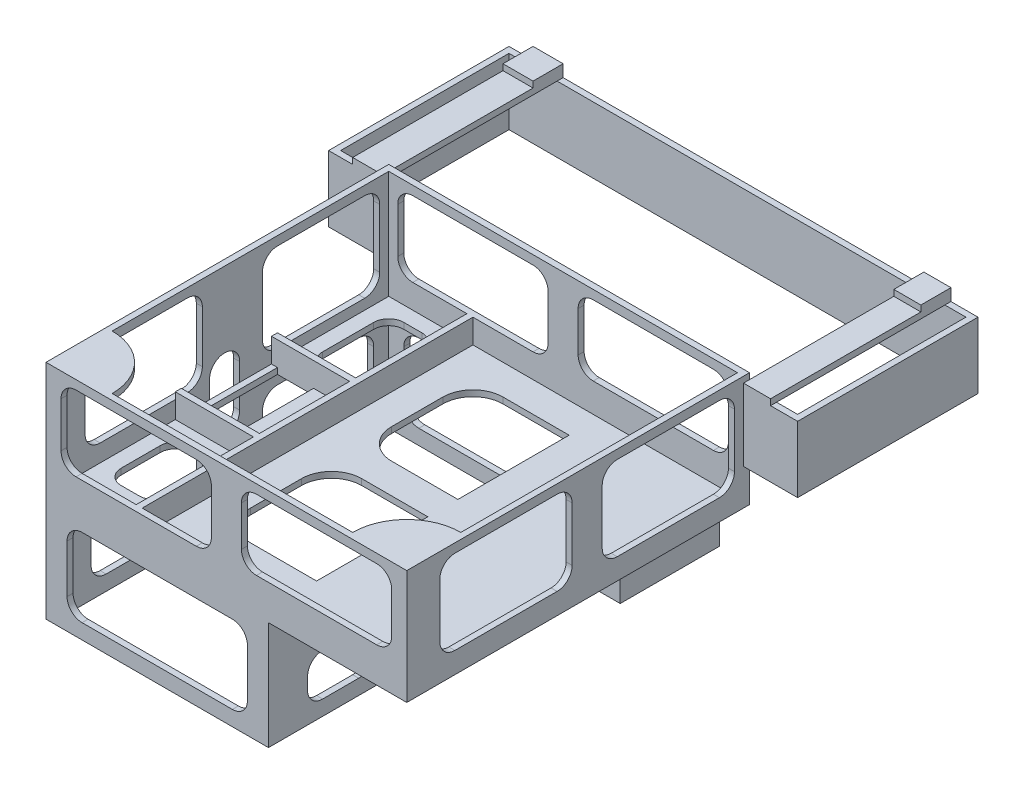
from build123d import *

# Parameters (mm, degrees)
SKETCH1_W                = 60
SKETCH1_H                = 54
BOSS_EXTRUDE1_DEPTH      = 38
SKETCH2_W                = 44
SKETCH2_H                = 52
CUT_EXTRUDE1_DEPTH       = 19
SKETCH3_W                = 35
SKETCH3_H                = 52
CUT_EXTRUDE2_DEPTH       = 18
SKETCH4_W                = 6
SKETCH4_H                = 15
CUT_EXTRUDE3_DEPTH       = 38
SKETCH5_W                = 14
SKETCH5_H                = 52
CUT_EXTRUDE5_DEPTH       = 15
SKETCH6_W                = 13
SKETCH6_H                = 52
CUT_EXTRUDE6_DEPTH       = 4
SKETCH8_W                = 14
SKETCH8_H                = 12.5
CUT_EXTRUDE7_DEPTH       = 6
SKETCH10_W               = 12.5
SKETCH10_H               = 5
CUT_EXTRUDE8_DEPTH       = 6
SKETCH11_W               = 4.5
SKETCH11_H               = 5
CUT_EXTRUDE9_DEPTH       = 18
SKETCH12_W               = 5
SKETCH12_H               = 17
CUT_EXTRUDE10_DEPTH      = 13
CUT_EXTRUDE11_DEPTH      = 1
SKETCH14_W               = 13
SKETCH14_H               = 1
BOSS_EXTRUDE2_DEPTH      = 4
SKETCH15_W               = 13
SKETCH15_H               = 1
BOSS_EXTRUDE3_DEPTH      = 4
CUT_EXTRUDE12_DEPTH      = 1
CUT_EXTRUDE13_DEPTH      = 1
CUT_EXTRUDE14_DEPTH      = 1
CUT_EXTRUDE15_DEPTH      = 60
CUT_EXTRUDE16_START      = -1
CUT_EXTRUDE16_DEPTH      = 1
CUT_EXTRUDE17_DEPTH      = 89
CUT_EXTRUDE17_DEPTH_BACK = 10
CUT_EXTRUDE18_DEPTH      = 10
SKETCH23_W               = 58
SKETCH23_H               = 52
BOSS_EXTRUDE4_DEPTH      = 1
SKETCH24_W               = 40
SKETCH24_H               = 10
SKETCH24_W_2             = 10
SKETCH24_H_2             = 34
CUT_EXTRUDE20_DEPTH      = 1
FILLET1_R                = 9
FILLET2_R                = 9
FILLET3_R                = 9
FILLET4_R                = 9
SKETCH27_W               = 10
SKETCH27_H               = 11
BOSS_EXTRUDE10_DEPTH     = 1
SKETCH31_W               = 1
SKETCH31_H               = 11
BOSS_EXTRUDE12_DEPTH     = 29
SKETCH33_W               = 1
SKETCH33_H               = 11
BOSS_EXTRUDE13_DEPTH     = 78
SKETCH34_W               = 5
SKETCH34_H               = 30
SKETCH34_W_2             = 4.5
BOSS_EXTRUDE14_DEPTH     = 1
SKETCH35_W               = 28
SKETCH35_H               = 11
BOSS_EXTRUDE15_DEPTH     = 1
SKETCH37_W               = 30
SKETCH37_H               = 11
CUT_EXTRUDE21_DEPTH      = 1
SKETCH38_W               = 28
SKETCH38_H               = 11
BOSS_EXTRUDE16_DEPTH     = 1
SKETCH39_W               = 30
SKETCH39_H               = 11
CUT_EXTRUDE22_DEPTH      = 1
SKETCH40_W               = 60
SKETCH40_H               = 37
BOSS_EXTRUDE17_DEPTH     = 3
SKETCH41_W               = 35
SKETCH41_H               = 18
CUT_EXTRUDE23_DEPTH      = 3
SKETCH42_W               = 44
SKETCH42_H               = 18
CUT_EXTRUDE24_DEPTH      = 3
SKETCH44_W               = 13
SKETCH44_H               = 18
CUT_EXTRUDE25_DEPTH      = 3
SKETCH45_W               = 3
SKETCH45_H               = 14
CUT_EXTRUDE26_DEPTH      = 3
SKETCH47_W               = 60
SKETCH47_H               = 10
CUT_EXTRUDE27_DEPTH      = 1
SKETCH48_W               = 60
SKETCH48_H               = 10
CUT_EXTRUDE28_DEPTH      = 1
SKETCH49_W               = 60
SKETCH49_H               = 10
BOSS_EXTRUDE18_DEPTH     = 1
SKETCH50_W               = 40
SKETCH50_H               = 9
CUT_EXTRUDE29_DEPTH      = 1
FILLET5_R                = 9
FILLET6_R                = 9
SKETCH51_W               = 5
SKETCH51_H               = 5
SKETCH51_W_2             = 4.5
BOSS_EXTRUDE19_DEPTH     = 1
SKETCH53_W               = 8
SKETCH53_H               = 9
CUT_EXTRUDE30_DEPTH      = 18
SKETCH54_W               = 2.5
SKETCH54_H               = 16.5
CUT_EXTRUDE31_DEPTH      = 18
SKETCH55_W               = 19.362337095
SKETCH55_H               = 47.149460103
BOSS_EXTRUDE20_DEPTH     = 1
SKETCH57_W               = 15
SKETCH57_H               = 9
CUT_EXTRUDE32_DEPTH      = 15
SKETCH58_W               = 6.289823119
SKETCH58_H               = 14.401479923
BOSS_EXTRUDE21_DEPTH     = 1
SKETCH59_W               = 15
SKETCH59_H               = 9
BOSS_EXTRUDE26_DEPTH     = 1
SKETCH60_W               = 4.5
SKETCH60_H               = 5
CUT_EXTRUDE33_DEPTH      = 1
SKETCH61_W               = 14
SKETCH61_H               = 12.5
CUT_EXTRUDE34_DEPTH      = 18
SKETCH62_W               = 12.5
SKETCH62_H               = 5
CUT_EXTRUDE35_DEPTH      = 18
SKETCH63_W               = 20.5
SKETCH63_H               = 16.5
CUT_EXTRUDE36_DEPTH      = 12
SKETCH64_W               = 13.575669256
SKETCH64_H               = 6.720460735
BOSS_EXTRUDE27_DEPTH     = 1
CUT_EXTRUDE37_START      = -1
CUT_EXTRUDE37_DEPTH      = 1
CUT_EXTRUDE38_DEPTH      = 1
CUT_EXTRUDE39_DEPTH      = 1


with BuildPart() as part:
    # Sketch1 → Boss-Extrude1 (new body)
    with BuildSketch(Plane(origin=(0, 0, 0), x_dir=(1, 0, 0), z_dir=(0, 1, 0))):
        with Locations((-83.874465942, -33.946435202)):
            Rectangle(SKETCH1_W, SKETCH1_H)
    extrude(amount=BOSS_EXTRUDE1_DEPTH)

    # Sketch2 → Cut-Extrude1 (cut)
    with BuildSketch(Plane(origin=(0, 38, 0), x_dir=(1, 0, 0), z_dir=(0, 1, 0))):
        with Locations((-76.874465942, -33.946435202)):
            Rectangle(SKETCH2_W, SKETCH2_H)
    extrude(amount=-CUT_EXTRUDE1_DEPTH, mode=Mode.SUBTRACT)

    # Sketch3 → Cut-Extrude2 (cut)
    with BuildSketch(Plane(origin=(0, 0, 0), x_dir=(-1, 0, 0), z_dir=(0, -1, 0))):
        with Locations((95.374465942, -33.946435202)):
            Rectangle(SKETCH3_W, SKETCH3_H)
    extrude(amount=-CUT_EXTRUDE2_DEPTH, mode=Mode.SUBTRACT)

    # Sketch4 → Cut-Extrude3 (cut)
    with BuildSketch(Plane(origin=(0, 18, 0), x_dir=(-1, 0, 0), z_dir=(0, -1, 0))):
        with Locations((108.874465942, -34.946435202)):
            Rectangle(SKETCH4_W, SKETCH4_H)
    extrude(amount=-CUT_EXTRUDE3_DEPTH, mode=Mode.SUBTRACT)

    # Sketch5 → Cut-Extrude5 (cut)
    with BuildSketch(Plane(origin=(0, 38, 0), x_dir=(1, 0, 0), z_dir=(0, 1, 0))):
        with Locations((-105.874465942, -33.946435202)):
            Rectangle(SKETCH5_W, SKETCH5_H)
    extrude(amount=-CUT_EXTRUDE5_DEPTH, mode=Mode.SUBTRACT)

    # Sketch6 → Cut-Extrude6 (cut)
    with BuildSketch(Plane(origin=(0, 23, 0), x_dir=(1, 0, 0), z_dir=(0, 1, 0))):
        with Locations((-106.374465942, -33.946435202)):
            Rectangle(SKETCH6_W, SKETCH6_H)
    extrude(amount=-CUT_EXTRUDE6_DEPTH, mode=Mode.SUBTRACT)

    # Sketch8 → Cut-Extrude7 (cut)
    with BuildSketch(Plane(origin=(0, 0, 0), x_dir=(-1, 0, 0), z_dir=(0, -1, 0))):
        with Locations((65.374465942, -17.696435202)):
            Rectangle(SKETCH8_W, SKETCH8_H)
    extrude(amount=-CUT_EXTRUDE7_DEPTH, mode=Mode.SUBTRACT)

    # Sketch10 → Cut-Extrude8 (cut)
    with BuildSketch(Plane(origin=(-72.374465942, 0, 0), x_dir=(0, 0, -1), z_dir=(1, 0, 0))):
        with Locations((-17.696435202, 3.5)):
            Rectangle(SKETCH10_W, SKETCH10_H)
    extrude(amount=-CUT_EXTRUDE8_DEPTH, mode=Mode.SUBTRACT)

    # Sketch11 → Cut-Extrude9 (cut)
    with BuildSketch(Plane.XZ):
        with Locations((-66.124465942, 48.446435202)):
            Rectangle(SKETCH11_W, SKETCH11_H)
    extrude(amount=-CUT_EXTRUDE9_DEPTH, mode=Mode.SUBTRACT)

    # Sketch12 → Cut-Extrude10 (cut)
    with BuildSketch(Plane(origin=(-68.374465942, 0, 0), x_dir=(0, 0, -1), z_dir=(1, 0, 0))):
        with Locations((-48.446435202, 9.5)):
            Rectangle(SKETCH12_W, SKETCH12_H)
    extrude(amount=-CUT_EXTRUDE10_DEPTH, mode=Mode.SUBTRACT)

    # Sketch13 → Cut-Extrude11 (cut)
    with BuildSketch(Plane.ZY.offset(113.874465942)):
        with BuildLine():
            Line((32.733045904, 15), (32.733045904, 22))
            ThreePointArc((32.733045904, 22), (35.233045904, 24.5), (37.733045904, 22))
            Line((37.733045904, 22), (37.733045904, 15))
            ThreePointArc((37.733045904, 15), (35.233045904, 12.5), (32.733045904, 15))
        make_face()
    extrude(amount=-CUT_EXTRUDE11_DEPTH, mode=Mode.SUBTRACT)

    # Sketch14 → Boss-Extrude2 (add)
    with BuildSketch(Plane(origin=(0, 19, 0), x_dir=(1, 0, 0), z_dir=(0, 1, 0))):
        with Locations((-106.374465942, -42.946435202)):
            Rectangle(SKETCH14_W, SKETCH14_H)
    extrude(amount=BOSS_EXTRUDE2_DEPTH)

    # Sketch15 → Boss-Extrude3 (add)
    with BuildSketch(Plane(origin=(0, 19, 0), x_dir=(1, 0, 0), z_dir=(0, 1, 0))):
        with Locations((-106.374465942, -26.946435202)):
            Rectangle(SKETCH15_W, SKETCH15_H)
    extrude(amount=BOSS_EXTRUDE3_DEPTH)

    # Sketch16 → Cut-Extrude12 (cut)
    with BuildSketch(Plane(origin=(0, 19, 0), x_dir=(1, 0, 0), z_dir=(0, 1, 0))):
        with BuildLine():
            Line((-64.874465942, -54.946435202), (-88.874465942, -54.946435202))
            ThreePointArc((-88.874465942, -54.946435202), (-92.409999848, -53.481969108), (-93.874465942, -49.946435202))
            Line((-93.874465942, -49.946435202), (-93.874465942, -41.446435202))
            ThreePointArc((-93.874465942, -41.446435202), (-92.409999848, -37.910901296), (-88.874465942, -36.446435202))
            Line((-88.874465942, -36.446435202), (-64.874465942, -36.446435202))
            ThreePointArc((-64.874465942, -36.446435202), (-61.338932037, -37.910901296), (-59.874465942, -41.446435202))
            Line((-59.874465942, -41.446435202), (-59.874465942, -49.946435202))
            ThreePointArc((-59.874465942, -49.946435202), (-61.338932037, -53.481969108), (-64.874465942, -54.946435202))
        make_face()
        with BuildLine():
            Line((-88.874465942, -31.446435202), (-64.874465942, -31.446435202))
            ThreePointArc((-64.874465942, -31.446435202), (-61.338932037, -29.981969108), (-59.874465942, -26.446435202))
            Line((-59.874465942, -26.446435202), (-59.874465942, -17.946435202))
            ThreePointArc((-59.874465942, -17.946435202), (-61.338932037, -14.410901296), (-64.874465942, -12.946435202))
            Line((-64.874465942, -12.946435202), (-88.874465942, -12.946435202))
            ThreePointArc((-88.874465942, -12.946435202), (-92.409999848, -14.410901296), (-93.874465942, -17.946435202))
            Line((-93.874465942, -17.946435202), (-93.874465942, -26.446435202))
            ThreePointArc((-93.874465942, -26.446435202), (-92.409999848, -29.981969108), (-88.874465942, -31.446435202))
        make_face()
    extrude(amount=-CUT_EXTRUDE12_DEPTH, mode=Mode.SUBTRACT)

    # Sketch17 → Cut-Extrude13 (cut)
    with BuildSketch(Plane(origin=(0, 19, 0), x_dir=(1, 0, 0), z_dir=(0, 1, 0))):
        with BuildLine():
            Line((-104.874465942, -57.446435202), (-107.874465942, -57.446435202))
            ThreePointArc((-107.874465942, -57.446435202), (-109.642232895, -56.714202155), (-110.374465942, -54.946435202))
            Line((-110.374465942, -54.946435202), (-110.374465942, -48.446435202))
            ThreePointArc((-110.374465942, -48.446435202), (-109.642232895, -46.678668249), (-107.874465942, -45.946435202))
            Line((-107.874465942, -45.946435202), (-104.874465942, -45.946435202))
            ThreePointArc((-104.874465942, -45.946435202), (-103.10669899, -46.678668249), (-102.374465942, -48.446435202))
            Line((-102.374465942, -48.446435202), (-102.374465942, -54.946435202))
            ThreePointArc((-102.374465942, -54.946435202), (-103.10669899, -56.714202155), (-104.874465942, -57.446435202))
        make_face()
        with BuildLine():
            Line((-104.874465942, -23.946435202), (-107.874465942, -23.946435202))
            ThreePointArc((-107.874465942, -23.946435202), (-109.642232895, -23.214202155), (-110.374465942, -21.446435202))
            Line((-110.374465942, -21.446435202), (-110.374465942, -12.946435202))
            ThreePointArc((-110.374465942, -12.946435202), (-109.642232895, -11.178668249), (-107.874465942, -10.446435202))
            Line((-107.874465942, -10.446435202), (-104.874465942, -10.446435202))
            ThreePointArc((-104.874465942, -10.446435202), (-103.10669899, -11.178668249), (-102.374465942, -12.946435202))
            Line((-102.374465942, -12.946435202), (-102.374465942, -21.446435202))
            ThreePointArc((-102.374465942, -21.446435202), (-103.10669899, -23.214202155), (-104.874465942, -23.946435202))
        make_face()
    extrude(amount=-CUT_EXTRUDE13_DEPTH, mode=Mode.SUBTRACT)

    # Sketch18 → Cut-Extrude14 (cut)
    with BuildSketch(Plane(origin=(-53.874465942, 0, 0), x_dir=(0, 0, -1), z_dir=(1, 0, 0))):
        with BuildLine():
            Line((-55.946435202, 35.5), (-38.946435202, 35.5))
            ThreePointArc((-38.946435202, 35.5), (-37.178668249, 34.767766953), (-36.446435202, 33))
            Line((-36.446435202, 33), (-36.446435202, 24))
            ThreePointArc((-36.446435202, 24), (-37.178668249, 22.232233047), (-38.946435202, 21.5))
            Line((-38.946435202, 21.5), (-55.946435202, 21.5))
            ThreePointArc((-55.946435202, 21.5), (-57.714202155, 22.232233047), (-58.446435202, 24))
            Line((-58.446435202, 24), (-58.446435202, 33))
            ThreePointArc((-58.446435202, 33), (-57.714202155, 34.767766953), (-55.946435202, 35.5))
        make_face()
        with BuildLine():
            Line((-28.946435202, 35.5), (-11.946435202, 35.5))
            ThreePointArc((-11.946435202, 35.5), (-10.178668249, 34.767766953), (-9.446435202, 33))
            Line((-9.446435202, 33), (-9.446435202, 24))
            ThreePointArc((-9.446435202, 24), (-10.178668249, 22.232233047), (-11.946435202, 21.5))
            Line((-11.946435202, 21.5), (-28.946435202, 21.5))
            ThreePointArc((-28.946435202, 21.5), (-30.714202155, 22.232233047), (-31.446435202, 24))
            Line((-31.446435202, 24), (-31.446435202, 33))
            ThreePointArc((-31.446435202, 33), (-30.714202155, 34.767766953), (-28.946435202, 35.5))
        make_face()
    extrude(amount=-CUT_EXTRUDE14_DEPTH, mode=Mode.SUBTRACT)

    # Sketch19 → Cut-Extrude15 (cut)
    with BuildSketch(Plane(origin=(0, 0, 6.946435202), x_dir=(-1, 0, 0), z_dir=(0, 0, -1))):
        with BuildLine():
            Line((58.874465942, 35.5), (78.874465942, 35.5))
            ThreePointArc((78.874465942, 35.5), (80.642232895, 34.767766953), (81.374465942, 33))
            Line((81.374465942, 33), (81.374465942, 26.304053451))
            ThreePointArc((81.374465942, 26.304053451), (80.642232895, 24.536286498), (78.874465942, 23.804053451))
            Line((78.874465942, 23.804053451), (58.874465942, 23.804053451))
            ThreePointArc((58.874465942, 23.804053451), (57.10669899, 24.536286498), (56.374465942, 26.304053451))
            Line((56.374465942, 26.304053451), (56.374465942, 33))
            ThreePointArc((56.374465942, 33), (57.10669899, 34.767766953), (58.874465942, 35.5))
        make_face()
        with BuildLine():
            Line((88.874465942, 35.5), (108.874465942, 35.5))
            ThreePointArc((108.874465942, 35.5), (110.642232895, 34.767766953), (111.374465942, 33))
            Line((111.374465942, 33), (111.374465942, 25.5))
            ThreePointArc((111.374465942, 25.5), (110.642232895, 23.732233047), (108.874465942, 23))
            Line((108.874465942, 23), (88.874465942, 23))
            ThreePointArc((88.874465942, 23), (87.10669899, 23.732233047), (86.374465942, 25.5))
            Line((86.374465942, 25.5), (86.374465942, 33))
            ThreePointArc((86.374465942, 33), (87.10669899, 34.767766953), (88.874465942, 35.5))
        make_face()
    extrude(amount=-CUT_EXTRUDE15_DEPTH, mode=Mode.SUBTRACT)

    # Sketch20 → Cut-Extrude16 (cut)
    with BuildSketch(Plane.ZY.offset(113.874465942).offset(CUT_EXTRUDE16_START)):
        with BuildLine():
            Line((11.946435202, 35.5), (26.446435202, 35.5))
            ThreePointArc((26.446435202, 35.5), (28.214202155, 34.767766953), (28.946435202, 33))
            Line((28.946435202, 33), (28.946435202, 23.221982389))
            ThreePointArc((28.946435202, 23.221982389), (28.214202155, 21.454215436), (26.446435202, 20.721982389))
            Line((26.446435202, 20.721982389), (11.946435202, 20.721982389))
            ThreePointArc((11.946435202, 20.721982389), (10.178668249, 21.454215436), (9.446435202, 23.221982389))
            Line((9.446435202, 23.221982389), (9.446435202, 33))
            ThreePointArc((9.446435202, 33), (10.178668249, 34.767766953), (11.946435202, 35.5))
        make_face()
        with BuildLine():
            Line((41.446435202, 35.5), (55.946435202, 35.5))
            ThreePointArc((55.946435202, 35.5), (57.714202155, 34.767766953), (58.446435202, 33))
            Line((58.446435202, 33), (58.446435202, 24.375603128))
            ThreePointArc((58.446435202, 24.375603128), (57.714202155, 22.607836175), (55.946435202, 21.875603128))
            Line((55.946435202, 21.875603128), (41.446435202, 21.875603128))
            ThreePointArc((41.446435202, 21.875603128), (39.678668249, 22.607836175), (38.946435202, 24.375603128))
            Line((38.946435202, 24.375603128), (38.946435202, 33))
            ThreePointArc((38.946435202, 33), (39.678668249, 34.767766953), (41.446435202, 35.5))
        make_face()
    extrude(amount=CUT_EXTRUDE16_DEPTH, mode=Mode.SUBTRACT)

    # Sketch21 → Cut-Extrude17 (cut, two sides: drawn at the far end of the back side and taken through both)
    with BuildSketch(Plane(origin=(0, 0, 59.946435202), x_dir=(-1, 0, 0), z_dir=(0, 0, -1)).offset(-CUT_EXTRUDE17_DEPTH_BACK)):
        with BuildLine():
            Line((107.874465942, 2.5), (82.874465942, 2.5))
            ThreePointArc((82.874465942, 2.5), (81.10669899, 3.232233047), (80.374465942, 5))
            Line((80.374465942, 5), (80.374465942, 13))
            ThreePointArc((80.374465942, 13), (81.10669899, 14.767766953), (82.874465942, 15.5))
            Line((82.874465942, 15.5), (107.874465942, 15.5))
            ThreePointArc((107.874465942, 15.5), (109.642232895, 14.767766953), (110.374465942, 13))
            Line((110.374465942, 13), (110.374465942, 5))
            ThreePointArc((110.374465942, 5), (109.642232895, 3.232233047), (107.874465942, 2.5))
        make_face()
    extrude(amount=CUT_EXTRUDE17_DEPTH + CUT_EXTRUDE17_DEPTH_BACK, mode=Mode.SUBTRACT)

    # Sketch22 → Cut-Extrude18 (cut)
    with BuildSketch(Plane(origin=(-112.874465942, 0, 0), x_dir=(0, 0, -1), z_dir=(1, 0, 0))):
        with BuildLine():
            Line((-12.946435202, 2.5), (-26.446435202, 2.5))
            ThreePointArc((-26.446435202, 2.5), (-28.214202155, 3.232233047), (-28.946435202, 5))
            Line((-28.946435202, 5), (-28.946435202, 13))
            ThreePointArc((-28.946435202, 13), (-28.214202155, 14.767766953), (-26.446435202, 15.5))
            Line((-26.446435202, 15.5), (-12.946435202, 15.5))
            ThreePointArc((-12.946435202, 15.5), (-11.178668249, 14.767766953), (-10.446435202, 13))
            Line((-10.446435202, 13), (-10.446435202, 5))
            ThreePointArc((-10.446435202, 5), (-11.178668249, 3.232233047), (-12.946435202, 2.5))
        make_face()
        with BuildLine():
            Line((-41.446435202, 2.5), (-54.946435202, 2.5))
            ThreePointArc((-54.946435202, 2.5), (-56.714202155, 3.232233047), (-57.446435202, 5))
            Line((-57.446435202, 5), (-57.446435202, 13))
            ThreePointArc((-57.446435202, 13), (-56.714202155, 14.767766953), (-54.946435202, 15.5))
            Line((-54.946435202, 15.5), (-41.446435202, 15.5))
            ThreePointArc((-41.446435202, 15.5), (-39.678668249, 14.767766953), (-38.946435202, 13))
            Line((-38.946435202, 13), (-38.946435202, 5))
            ThreePointArc((-38.946435202, 5), (-39.678668249, 3.232233047), (-41.446435202, 2.5))
        make_face()
    extrude(amount=-CUT_EXTRUDE18_DEPTH, mode=Mode.SUBTRACT)

    # Sketch23 → Boss-Extrude4 (add)
    with BuildSketch(Plane(origin=(0, 38, 0), x_dir=(1, 0, 0), z_dir=(0, 1, 0))):
        with Locations((-83.874465942, -33.946435202)):
            Rectangle(SKETCH23_W, SKETCH23_H)
    extrude(amount=-BOSS_EXTRUDE4_DEPTH)

    # Sketch24 → Cut-Extrude20 (cut)
    with BuildSketch(Plane(origin=(0, 38, 0), x_dir=(1, 0, 0), z_dir=(0, 1, 0))):
        with Locations((-83.874465942, -55.946435202)):
            Rectangle(SKETCH24_W, SKETCH24_H)
        with Locations((-58.874465942, -33.946435202)):
            Rectangle(SKETCH24_W_2, SKETCH24_H_2)
        with Locations((-83.874465942, -11.946435202)):
            Rectangle(SKETCH24_W, SKETCH24_H)
        with Locations((-83.874465942, -33.946435202)):
            Rectangle(SKETCH24_W, SKETCH24_H_2)
        with Locations((-108.874465942, -33.946435202)):
            Rectangle(SKETCH24_W_2, SKETCH24_H_2)
    extrude(amount=-CUT_EXTRUDE20_DEPTH, mode=Mode.SUBTRACT)

    # Fillet1
    fillet1_edges = [part.edges().sort_by_distance(p)[0] for p in [
        (-103.874465942, 37.5, 50.946435202),
    ]]
    fillet(fillet1_edges, radius=FILLET1_R)

    # Fillet2
    fillet2_edges = [part.edges().sort_by_distance(p)[0] for p in [
        (-63.874465942, 37.5, 16.946435202),
    ]]
    fillet(fillet2_edges, radius=FILLET2_R)

    # Fillet3
    fillet3_edges = [part.edges().sort_by_distance(p)[0] for p in [
        (-63.874465942, 37.5, 50.946435202),
    ]]
    fillet(fillet3_edges, radius=FILLET3_R)

    # Fillet4
    fillet4_edges = [part.edges().sort_by_distance(p)[0] for p in [
        (-103.874465942, 37.5, 16.946435202),
    ]]
    fillet(fillet4_edges, radius=FILLET4_R)

    # Sketch27 → Boss-Extrude10 (add)
    with BuildSketch(Plane(origin=(0, 0, 6.946435202), x_dir=(-1, 0, 0), z_dir=(0, 0, -1))):
        with Locations((48.874465942, 29.5)):
            Rectangle(SKETCH27_W, SKETCH27_H)
        with Locations((118.874465942, 29.5)):
            Rectangle(SKETCH27_W, SKETCH27_H)
    extrude(amount=-BOSS_EXTRUDE10_DEPTH)

    # Sketch31 → Boss-Extrude12 (add)
    with BuildSketch(Plane(origin=(0, 0, 6.946435202), x_dir=(-1, 0, 0), z_dir=(0, 0, -1))):
        with Locations((44.374465942, 29.5)):
            Rectangle(SKETCH31_W, SKETCH31_H)
        with Locations((123.374465942, 29.5)):
            Rectangle(SKETCH31_W, SKETCH31_H)
    extrude(amount=BOSS_EXTRUDE12_DEPTH)

    # Sketch33 → Boss-Extrude13 (add)
    with BuildSketch(Plane.ZY.offset(44.874465942)):
        with Locations((-21.553564798, 29.5)):
            Rectangle(SKETCH33_W, SKETCH33_H)
    extrude(amount=BOSS_EXTRUDE13_DEPTH)

    # Sketch34 → Boss-Extrude14 (add)
    with BuildSketch(Plane(origin=(0, 35, 0), x_dir=(1, 0, 0), z_dir=(0, 1, 0))):
        with Locations((-116.374465942, 7.053564798)):
            Rectangle(SKETCH34_W, SKETCH34_H)
        with Locations((-51.624465942, 7.053564798)):
            Rectangle(SKETCH34_W_2, SKETCH34_H)
    extrude(amount=BOSS_EXTRUDE14_DEPTH)

    # Sketch35 → Boss-Extrude15 (add)
    with BuildSketch(Plane(origin=(-122.874465942, 0, 0), x_dir=(0, 0, -1), z_dir=(1, 0, 0))):
        with Locations((7.053564798, 29.5)):
            Rectangle(SKETCH35_W, SKETCH35_H)
    extrude(amount=BOSS_EXTRUDE15_DEPTH)

    # Sketch37 → Cut-Extrude21 (cut)
    with BuildSketch(Plane.ZY.offset(123.874465942)):
        with Locations((-7.053564798, 29.5)):
            Rectangle(SKETCH37_W, SKETCH37_H)
    extrude(amount=-CUT_EXTRUDE21_DEPTH, mode=Mode.SUBTRACT)

    # Sketch38 → Boss-Extrude16 (add)
    with BuildSketch(Plane.ZY.offset(44.874465942)):
        with Locations((-7.053564798, 29.5)):
            Rectangle(SKETCH38_W, SKETCH38_H)
    extrude(amount=BOSS_EXTRUDE16_DEPTH)

    # Sketch39 → Cut-Extrude22 (cut)
    with BuildSketch(Plane(origin=(-43.874465942, 0, 0), x_dir=(0, 0, -1), z_dir=(1, 0, 0))):
        with Locations((7.053564798, 29.5)):
            Rectangle(SKETCH39_W, SKETCH39_H)
    extrude(amount=-CUT_EXTRUDE22_DEPTH, mode=Mode.SUBTRACT)

    # Sketch40 → Boss-Extrude17 (add)
    with BuildSketch(Plane.XY.offset(60.946435202)):
        with Locations((-83.874465942, 18.5)):
            Rectangle(SKETCH40_W, SKETCH40_H)
    extrude(amount=BOSS_EXTRUDE17_DEPTH)

    # Sketch41 → Cut-Extrude23 (cut)
    with BuildSketch(Plane(origin=(0, 0, 59.946435202), x_dir=(-1, 0, 0), z_dir=(0, 0, -1))):
        with Locations((95.374465942, 9)):
            Rectangle(SKETCH41_W, SKETCH41_H)
    extrude(amount=-CUT_EXTRUDE23_DEPTH, mode=Mode.SUBTRACT)

    # Sketch42 → Cut-Extrude24 (cut)
    with BuildSketch(Plane(origin=(0, 0, 59.946435202), x_dir=(-1, 0, 0), z_dir=(0, 0, -1))):
        with Locations((76.874465942, 28)):
            Rectangle(SKETCH42_W, SKETCH42_H)
    extrude(amount=-CUT_EXTRUDE24_DEPTH, mode=Mode.SUBTRACT)

    # Sketch44 → Cut-Extrude25 (cut)
    with BuildSketch(Plane(origin=(0, 0, 59.946435202), x_dir=(-1, 0, 0), z_dir=(0, 0, -1))):
        with Locations((106.374465942, 28)):
            Rectangle(SKETCH44_W, SKETCH44_H)
    extrude(amount=-CUT_EXTRUDE25_DEPTH, mode=Mode.SUBTRACT)

    # Sketch45 → Cut-Extrude26 (cut)
    with BuildSketch(Plane(origin=(-98.874465942, 0, 0), x_dir=(0, 0, -1), z_dir=(1, 0, 0))):
        with Locations((-61.446435202, 30)):
            Rectangle(SKETCH45_W, SKETCH45_H)
    extrude(amount=-CUT_EXTRUDE26_DEPTH, mode=Mode.SUBTRACT)

    # Sketch47 → Cut-Extrude27 (cut)
    with BuildSketch(Plane(origin=(0, 38, 0), x_dir=(1, 0, 0), z_dir=(0, 1, 0))):
        with Locations((-83.874465942, -11.946435202)):
            Rectangle(SKETCH47_W, SKETCH47_H)
    extrude(amount=-CUT_EXTRUDE27_DEPTH, mode=Mode.SUBTRACT)

    # Sketch48 → Cut-Extrude28 (cut)
    with BuildSketch(Plane(origin=(0, 38, 0), x_dir=(1, 0, 0), z_dir=(0, 1, 0))):
        with Locations((-83.874465942, -55.946435202)):
            Rectangle(SKETCH48_W, SKETCH48_H)
    extrude(amount=-CUT_EXTRUDE28_DEPTH, mode=Mode.SUBTRACT)

    # Sketch49 → Boss-Extrude18 (add)
    with BuildSketch(Plane(origin=(0, 37, 0), x_dir=(1, 0, 0), z_dir=(0, 1, 0))):
        with Locations((-83.874465942, -58.946435202)):
            Rectangle(SKETCH49_W, SKETCH49_H)
    extrude(amount=-BOSS_EXTRUDE18_DEPTH)

    # Sketch50 → Cut-Extrude29 (cut)
    with BuildSketch(Plane(origin=(0, 37, 0), x_dir=(1, 0, 0), z_dir=(0, 1, 0))):
        with Locations((-83.874465942, -58.446435202)):
            Rectangle(SKETCH50_W, SKETCH50_H)
    extrude(amount=-CUT_EXTRUDE29_DEPTH, mode=Mode.SUBTRACT)

    # Fillet5
    fillet5_edges = [part.edges().sort_by_distance(p)[0] for p in [
        (-103.874465942, 36.5, 53.946435202),
    ]]
    fillet(fillet5_edges, radius=FILLET5_R - 0.0001)  # a hair under: the kernel refuses the full size

    # Fillet6
    fillet6_edges = [part.edges().sort_by_distance(p)[0] for p in [
        (-63.874465942, 36.5, 53.946435202),
    ]]
    fillet(fillet6_edges, radius=FILLET6_R - 0.0001)  # a hair under: the kernel refuses the full size

    # Sketch51 → Boss-Extrude19 (add)
    with BuildSketch(Plane(origin=(0, 36, 0), x_dir=(1, 0, 0), z_dir=(0, 1, 0))):
        with Locations((-116.374465942, 19.553564798)):
            Rectangle(SKETCH51_W, SKETCH51_H)
        with Locations((-51.624465942, 19.553564798)):
            Rectangle(SKETCH51_W_2, SKETCH51_H)
    extrude(amount=BOSS_EXTRUDE19_DEPTH)

    # Sketch53 → Cut-Extrude30 (cut)
    with BuildSketch(Plane(origin=(0, 0, 0), x_dir=(-1, 0, 0), z_dir=(0, -1, 0))):
        Polygon((76.874465942, -34.339205591), (53.874465942, -34.339205591), (53.874465942, -43.946435202), (61.874465942, -43.946435202), (76.874465942, -43.946435202), align=None)
        with Locations((57.874465942, -48.446435202)):
            Rectangle(SKETCH53_W, SKETCH53_H)
        Polygon((61.874465942, -52.946435202), (53.874465942, -52.946435202), (53.874465942, -63.946435202), (76.874465942, -63.946435202), (76.874465942, -52.946435202), align=None)
    extrude(amount=-CUT_EXTRUDE30_DEPTH, mode=Mode.SUBTRACT)

    # Sketch54 → Cut-Extrude31 (cut)
    with BuildSketch(Plane(origin=(0, 0, 0), x_dir=(-1, 0, 0), z_dir=(0, -1, 0))):
        Polygon((53.874465942, -25.946435202), (53.874465942, -34.339205591), (76.874465942, -34.339205591), (76.874465942, -25.946435202), (56.374465942, -25.946435202), align=None)
        with Locations((55.124465942, -17.696435202)):
            Rectangle(SKETCH54_W, SKETCH54_H)
        Polygon((53.874465942, -6.946435202), (53.874465942, -9.446435202), (56.374465942, -9.446435202), (76.874465942, -9.446435202), (76.874465942, -6.946435202), align=None)
    extrude(amount=-CUT_EXTRUDE31_DEPTH, mode=Mode.SUBTRACT)

    # Sketch55 → Boss-Extrude20 (add)
    with BuildSketch(Plane(origin=(0, 19, 0), x_dir=(1, 0, 0), z_dir=(0, 1, 0))):
        with Locations((-68.193297395, -34.218039862)):
            Rectangle(SKETCH55_W, SKETCH55_H)
    extrude(amount=-BOSS_EXTRUDE20_DEPTH)

    # Sketch57 → Cut-Extrude32 (cut)
    with BuildSketch(Plane(origin=(0, 0, 0), x_dir=(-1, 0, 0), z_dir=(0, -1, 0))):
        with Locations((69.374465942, -48.446435202)):
            Rectangle(SKETCH57_W, SKETCH57_H)
    extrude(amount=-CUT_EXTRUDE32_DEPTH, mode=Mode.SUBTRACT)

    # Sketch58 → Boss-Extrude21 (add)
    with BuildSketch(Plane(origin=(-76.874465942, 0, 0), x_dir=(0, 0, -1), z_dir=(1, 0, 0))):
        with Locations((-48.091346762, 7.799260039)):
            Rectangle(SKETCH58_W, SKETCH58_H)
    extrude(amount=-BOSS_EXTRUDE21_DEPTH)

    # Sketch59 → Boss-Extrude26 (add)
    with BuildSketch(Plane(origin=(0, 15, 0), x_dir=(-1, 0, 0), z_dir=(0, -1, 0))):
        with Locations((69.374465942, -48.446435202)):
            Rectangle(SKETCH59_W, SKETCH59_H)
    extrude(amount=BOSS_EXTRUDE26_DEPTH)

    # Sketch60 → Cut-Extrude33 (cut)
    with BuildSketch(Plane(origin=(0, 14, 0), x_dir=(-1, 0, 0), z_dir=(0, -1, 0))):
        with Locations((66.124465942, -48.446435202)):
            Rectangle(SKETCH60_W, SKETCH60_H)
    extrude(amount=-CUT_EXTRUDE33_DEPTH, mode=Mode.SUBTRACT)

    # Sketch61 → Cut-Extrude34 (cut)
    with BuildSketch(Plane(origin=(0, 0, 0), x_dir=(-1, 0, 0), z_dir=(0, -1, 0))):
        with Locations((65.374465942, -17.696435202)):
            Rectangle(SKETCH61_W, SKETCH61_H)
    extrude(amount=-CUT_EXTRUDE34_DEPTH, mode=Mode.SUBTRACT)

    # Sketch62 → Cut-Extrude35 (cut)
    with BuildSketch(Plane.ZY.offset(77.874465942)):
        with Locations((17.696435202, 15.5)):
            Rectangle(SKETCH62_W, SKETCH62_H)
    extrude(amount=-CUT_EXTRUDE35_DEPTH, mode=Mode.SUBTRACT)

    # Sketch63 → Cut-Extrude36 (cut)
    with BuildSketch(Plane.XZ):
        with Locations((-66.624465942, 17.696435202)):
            Rectangle(SKETCH63_W, SKETCH63_H)
    extrude(amount=-CUT_EXTRUDE36_DEPTH, mode=Mode.SUBTRACT)

    # Sketch64 → Boss-Extrude27 (add)
    with BuildSketch(Plane(origin=(-76.874465942, 0, 0), x_dir=(0, 0, -1), z_dir=(1, 0, 0))):
        with Locations((-17.519703537, 4.074104241)):
            Rectangle(SKETCH64_W, SKETCH64_H)
    extrude(amount=-BOSS_EXTRUDE27_DEPTH)

    # Sketch65 → Cut-Extrude37 (cut)
    with BuildSketch(Plane.XY.offset(63.946435202).offset(CUT_EXTRUDE37_START)):
        with BuildLine():
            Line((-108.874465942, 35.5), (-88.874465942, 35.5))
            ThreePointArc((-88.874465942, 35.5), (-87.10669899, 34.767766953), (-86.374465942, 33))
            Line((-86.374465942, 33), (-86.374465942, 25.5))
            ThreePointArc((-86.374465942, 25.5), (-87.10669899, 23.732233047), (-88.874465942, 23))
            Line((-88.874465942, 23), (-108.874465942, 23))
            ThreePointArc((-108.874465942, 23), (-110.642232895, 23.732233047), (-111.374465942, 25.5))
            Line((-111.374465942, 25.5), (-111.374465942, 33))
            ThreePointArc((-111.374465942, 33), (-110.642232895, 34.767766953), (-108.874465942, 35.5))
        make_face()
        with BuildLine():
            Line((-78.874465942, 35.5), (-58.874465942, 35.5))
            ThreePointArc((-58.874465942, 35.5), (-57.10669899, 34.767766953), (-56.374465942, 33))
            Line((-56.374465942, 33), (-56.374465942, 26.304053451))
            ThreePointArc((-56.374465942, 26.304053451), (-57.10669899, 24.536286498), (-58.874465942, 23.804053451))
            Line((-58.874465942, 23.804053451), (-78.874465942, 23.804053451))
            ThreePointArc((-78.874465942, 23.804053451), (-80.642232895, 24.536286498), (-81.374465942, 26.304053451))
            Line((-81.374465942, 26.304053451), (-81.374465942, 33))
            ThreePointArc((-81.374465942, 33), (-80.642232895, 34.767766953), (-78.874465942, 35.5))
        make_face()
    extrude(amount=CUT_EXTRUDE37_DEPTH, mode=Mode.SUBTRACT)

    # Sketch66 → Cut-Extrude38 (cut)
    with BuildSketch(Plane.XY.offset(63.946435202)):
        with BuildLine():
            Line((-107.874465942, 15.5), (-82.874465942, 15.5))
            ThreePointArc((-82.874465942, 15.5), (-81.10669899, 14.767766953), (-80.374465942, 13))
            Line((-80.374465942, 13), (-80.374465942, 5))
            ThreePointArc((-80.374465942, 5), (-81.10669899, 3.232233047), (-82.874465942, 2.5))
            Line((-82.874465942, 2.5), (-107.874465942, 2.5))
            ThreePointArc((-107.874465942, 2.5), (-109.642232895, 3.232233047), (-110.374465942, 5))
            Line((-110.374465942, 5), (-110.374465942, 13))
            ThreePointArc((-110.374465942, 13), (-109.642232895, 14.767766953), (-107.874465942, 15.5))
        make_face()
    extrude(amount=-CUT_EXTRUDE38_DEPTH, mode=Mode.SUBTRACT)

    # Sketch67 → Cut-Extrude39 (cut)
    with BuildSketch(Plane(origin=(-76.874465942, 0, 0), x_dir=(0, 0, -1), z_dir=(1, 0, 0))):
        with BuildLine():
            Line((-38.946435202, 2.5), (-28.946435202, 2.5))
            ThreePointArc((-28.946435202, 2.5), (-27.178668249, 3.232233047), (-26.446435202, 5))
            Line((-26.446435202, 5), (-26.446435202, 13))
            ThreePointArc((-26.446435202, 13), (-27.178668249, 14.767766953), (-28.946435202, 15.5))
            Line((-28.946435202, 15.5), (-38.946435202, 15.5))
            ThreePointArc((-38.946435202, 15.5), (-40.714202155, 14.767766953), (-41.446435202, 13))
            Line((-41.446435202, 13), (-41.446435202, 5))
            ThreePointArc((-41.446435202, 5), (-40.714202155, 3.232233047), (-38.946435202, 2.5))
        make_face()
        with BuildLine():
            Line((-18.946435202, 2.5), (-12.946435202, 2.5))
            ThreePointArc((-12.946435202, 2.5), (-11.178668249, 3.232233047), (-10.446435202, 5))
            Line((-10.446435202, 5), (-10.446435202, 7))
            ThreePointArc((-10.446435202, 7), (-11.178668249, 8.767766953), (-12.946435202, 9.5))
            Line((-12.946435202, 9.5), (-18.946435202, 9.5))
            ThreePointArc((-18.946435202, 9.5), (-20.714202155, 8.767766953), (-21.446435202, 7))
            Line((-21.446435202, 7), (-21.446435202, 5))
            ThreePointArc((-21.446435202, 5), (-20.714202155, 3.232233047), (-18.946435202, 2.5))
        make_face()
        with BuildLine():
            Line((-54.946435202, 2.5), (-48.946435202, 2.5))
            ThreePointArc((-48.946435202, 2.5), (-47.178668249, 3.232233047), (-46.446435202, 5))
            Line((-46.446435202, 5), (-46.446435202, 7))
            ThreePointArc((-46.446435202, 7), (-47.178668249, 8.767766953), (-48.946435202, 9.5))
            Line((-48.946435202, 9.5), (-54.946435202, 9.5))
            ThreePointArc((-54.946435202, 9.5), (-56.714202155, 8.767766953), (-57.446435202, 7))
            Line((-57.446435202, 7), (-57.446435202, 5))
            ThreePointArc((-57.446435202, 5), (-56.714202155, 3.232233047), (-54.946435202, 2.5))
        make_face()
    extrude(amount=-CUT_EXTRUDE39_DEPTH, mode=Mode.SUBTRACT)


solid = part.part
